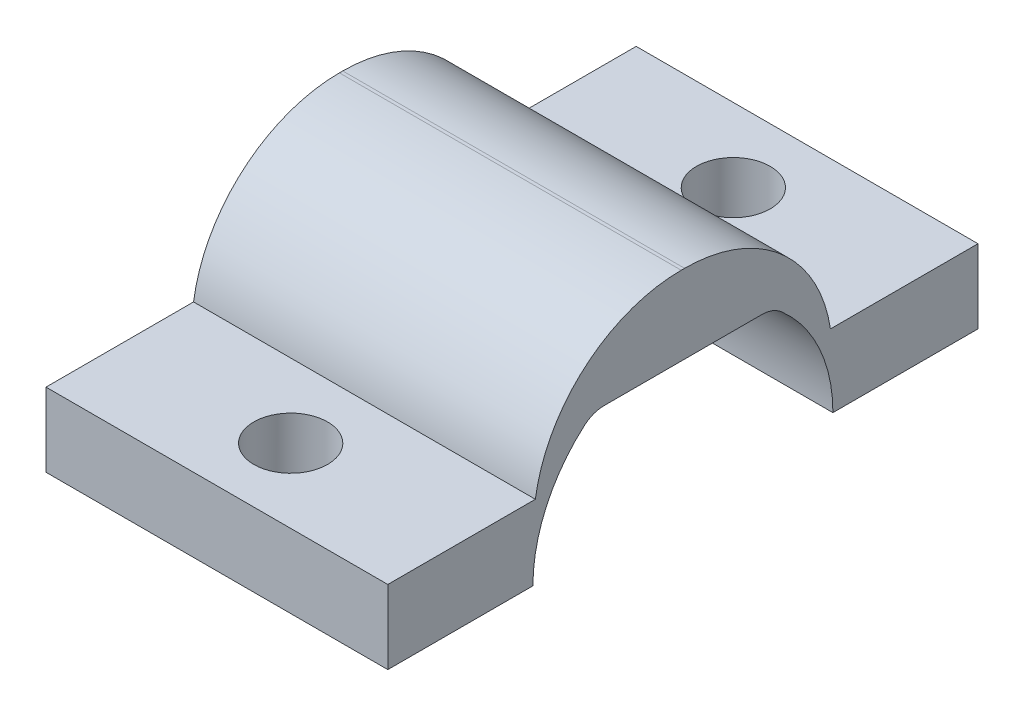
from build123d import *

# Parameters (mm, degrees)
RESSALTO_EXTRUS_O1_DEPTH   = 15.9
FILETE1_R                  = 6
FILETE2_R                  = 1.2
CORTE_EXTRUS_O2_DEPTH      = 20.463298795
CORTE_EXTRUS_O2_DEPTH_BACK = 20.463298795
ESBO_O3_W                  = 2
ESBO_O3_H                  = 20.053518914
ESBO_O4_W                  = 13.9
ESBO_O4_H                  = 3
RESSALTO_EXTRUS_O2_DEPTH   = 2
ESBO_O5_W                  = 13.9
ESBO_O5_H                  = 3
RESSALTO_EXTRUS_O3_DEPTH   = 2
CORTE_EXTRUS_O3_DEPTH      = 10


with BuildPart() as part:
    # Esboço1 → Ressalto-extrusão1 (new body)
    with BuildSketch(Plane(origin=(0, 0, 0), x_dir=(0, 0, -1), z_dir=(1, 0, 0))):
        with BuildLine():
            ThreePointArc((-3.633180425, 4.9), (-1.913112647, 5.792236183), (0, 6.1))
            ThreePointArc((0, 6.1), (1.913112647, 5.792236183), (3.633180425, 4.9))
            ThreePointArc((3.633180425, 4.9), (5.448504409, 2.742954557), (6.1, 0))
            Line((6.1, 0), (10, 0))
            Line((10, 0), (10, 3))
            Line((10, 3), (6, 3))
            Line((6, 3), (6, 8.1))
            Line((6, 8.1), (-6, 8.1))
            Line((-6, 8.1), (-6, 3))
            Line((-6, 3), (-10, 3))
            Line((-10, 3), (-10, 0))
            Line((-10, 0), (-6.1, 0))
            ThreePointArc((-6.1, 0), (-5.448504409, 2.742954557), (-3.633180425, 4.9))
        make_face()
        with BuildLine():
            ThreePointArc((3.633180425, 4.9), (1.913112647, 5.792236183), (0, 6.1))
            Line((0, 6.1), (0, 4.9))
            Line((0, 4.9), (3.633180425, 4.9))
        make_face()
        with BuildLine():
            Line((0, 4.9), (0, 6.1))
            ThreePointArc((0, 6.1), (-1.913112647, 5.792236183), (-3.633180425, 4.9))
            Line((-3.633180425, 4.9), (0, 4.9))
        make_face()
    extrude(amount=RESSALTO_EXTRUS_O1_DEPTH)

    # Filete1
    # the kernel refuses this fillet: 6 mm, written as the material it takes off along each edge
    with BuildSketch(Plane(origin=(-14.83028995, 8.1, 6), x_dir=(0, -1, 0), z_dir=(1, 0, 0))) as filete1_piece_1:
        with BuildLine():
            CenterArc((6, 5.93211598), FILETE1_R, 180, 81.373073441)
            Line((0, 5.93211598), (-0.12, 5.93211598))
            Line((-0.12, 5.93211598), (-0.12, 0))
            Line((-0.12, 0), (0, -0.12))
            ThreePointArc((0, -0.12), (2.55, -0.12), (5.082, -0.11864232))
            Line((5.082, -0.11864232), (5.1, 0))
        make_face()
    extrude(amount=45.5605799, mode=Mode.SUBTRACT)
    with BuildSketch(Plane(origin=(-14.83028995, 8.1, -6), x_dir=(0, -1, 0), z_dir=(1, 0, 0))) as filete1_piece_2:
        with BuildLine():
            CenterArc((6, -5.93211598), FILETE1_R, 98.626926559, 81.373073441)
            Line((0, -5.93211598), (-0.12, -5.93211598))
            Line((-0.12, -5.93211598), (-0.12, 0))
            Line((-0.12, 0), (0, 0.12))
            ThreePointArc((0, 0.12), (2.55, 0.12), (5.082, 0.11864232))
            Line((5.082, 0.11864232), (5.1, 0))
        make_face()
    extrude(amount=45.5605799, mode=Mode.SUBTRACT)

    # Filete2
    filete2_edges = [part.edges().sort_by_distance(p)[0] for p in [
        (7.95, 4.9, -3.633180425),
        (7.95, 4.9, 3.633180425),
    ]]
    fillet(filete2_edges, radius=FILETE2_R)

    # Esboço3 → Corte-extrusão2 (cut, two sides: drawn at the far end of the back side and taken through both)
    with BuildSketch(Plane(origin=(0, 3, 0), x_dir=(1, 0, 0), z_dir=(0, 1, 0)).offset(-CORTE_EXTRUS_O2_DEPTH_BACK)):
        with Locations((1, -0.026759457)):
            Rectangle(ESBO_O3_W, ESBO_O3_H)
    extrude(amount=CORTE_EXTRUS_O2_DEPTH + CORTE_EXTRUS_O2_DEPTH_BACK, mode=Mode.SUBTRACT)

    # Esboço4 → Ressalto-extrusão2 (add)
    with BuildSketch(Plane.XY.offset(10)):
        with Locations((8.95, 1.5)):
            Rectangle(ESBO_O4_W, ESBO_O4_H)
    extrude(amount=RESSALTO_EXTRUS_O2_DEPTH)

    # Esboço5 → Ressalto-extrusão3 (add)
    with BuildSketch(Plane(origin=(0, 0, -10), x_dir=(-1, 0, 0), z_dir=(0, 0, -1))):
        with Locations((-8.95, 1.5)):
            Rectangle(ESBO_O5_W, ESBO_O5_H)
    extrude(amount=RESSALTO_EXTRUS_O3_DEPTH)

    # Esboço8 → Corte-extrusão3 (cut)
    with BuildSketch(Plane(origin=(0, 3, 0), x_dir=(1, 0, 0), z_dir=(0, 1, 0))):
        with BuildLine():
            ThreePointArc((10.45, 9), (8.95, 10.5), (7.45, 9))
            Line((7.45, 9), (10.45, 9))
        make_face()
        with BuildLine():
            Line((10.45, 9), (7.45, 9))
            ThreePointArc((7.45, 9), (8.95, 7.5), (10.45, 9))
        make_face()
        with BuildLine():
            ThreePointArc((10.45, -9), (8.95, -7.5), (7.45, -9))
            Line((7.45, -9), (10.45, -9))
        make_face()
        with BuildLine():
            Line((10.45, -9), (7.45, -9))
            ThreePointArc((7.45, -9), (8.95, -10.5), (10.45, -9))
        make_face()
    extrude(amount=-CORTE_EXTRUS_O3_DEPTH, mode=Mode.SUBTRACT)


solid = part.part
